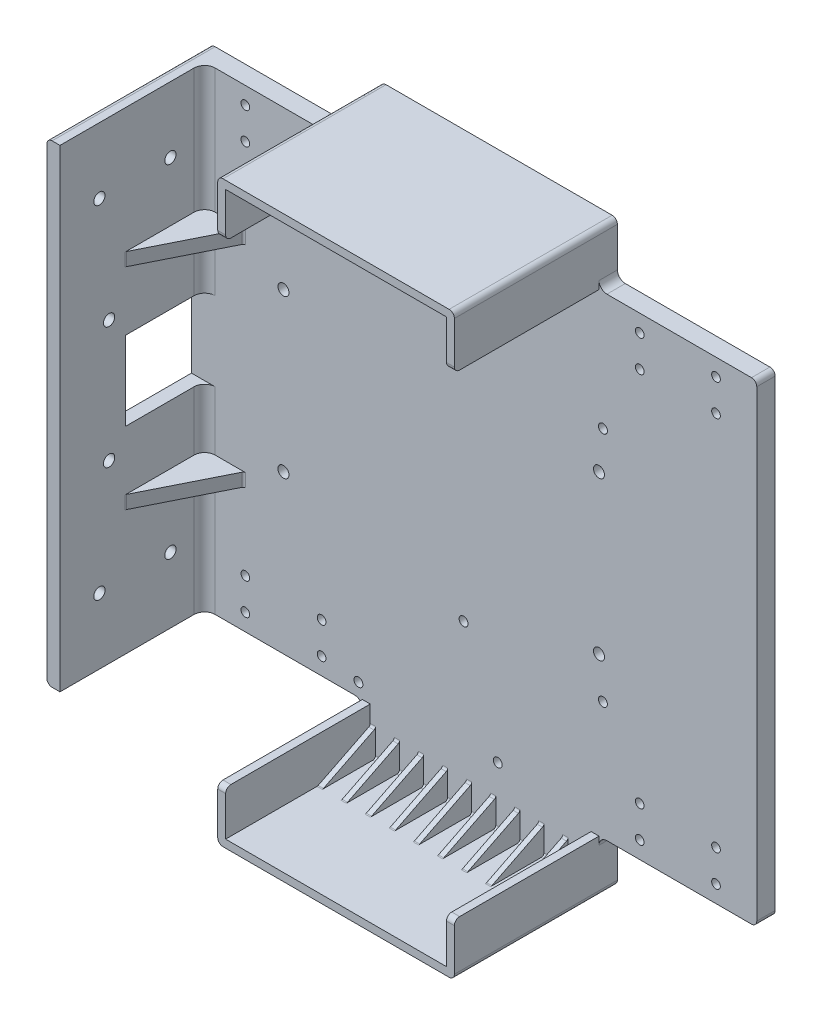
from build123d import *

# Parameters (mm, degrees)
SKETCH2_W               = 210
SKETCH2_H               = 180
BOSS_EXTRUDE1_DEPTH     = 7
SKETCH3_W               = 90
SKETCH3_H               = 7
BOSS_EXTRUDE2_DEPTH     = 20
SKETCH4_W               = 90
SKETCH4_H               = 7
BOSS_EXTRUDE3_DEPTH     = 20
SKETCH5_R               = 1.65
SKETCH5_R_2             = 2.1
SKETCH5_R_3             = 1.7
CUT_EXTRUDE1_DEPTH      = 153.23008901
SKETCH10_W              = 5
SKETCH10_H              = 180
SKETCH10_W_2            = 3
SKETCH10_H_2            = 3
SKETCH10_W_3            = 84
SKETCH10_H_3            = 17
BOSS_EXTRUDE4_DEPTH     = 55
SKETCH12_W              = 5
SKETCH12_H              = 180
BOSS_EXTRUDE5_DEPTH     = 7
FILLET2_R               = 2
FILLET10_R              = 3
FILLET11_R              = 3
FILLET13_R              = 3
FILLET15_R              = 3
FILLET20_R              = 2
BOSS_EXTRUDE6_DEPTH     = 2
LPATTERN1_COUNT         = 10
LPATTERN1_PITCH         = 9.15
MIRROR1_COPY_1_DEPTH    = 2
MIRROR1_COPY_2_DEPTH    = 2
MIRROR1_COPY_3_DEPTH    = 2
MIRROR1_COPY_4_DEPTH    = 2
MIRROR1_COPY_5_DEPTH    = 2
MIRROR1_COPY_6_DEPTH    = 2
MIRROR1_COPY_7_DEPTH    = 2
MIRROR1_COPY_8_DEPTH    = 2
MIRROR1_COPY_9_DEPTH    = 2
MIRROR1_COPY_10_DEPTH   = 2
FILLET24_R              = 4
SKETCH17_R              = 2.15
CUT_EXTRUDE2_DEPTH      = 10
FILLET25_R              = 1
RIB1_REACH              = 198.071
SKETCH18_WALL_W         = 427.683850784
SKETCH18_WALL_H         = 5
RIB2_REACH              = 198.071
SKETCH19_WALL_W         = 427.683850784
SKETCH19_WALL_H         = 5
FILLET26_R              = 1
FILLET27_R              = 1
CUT_EXTRUDE3_DEPTH      = 10
CUT_EXTRUDE3_DEPTH_BACK = 10
SKETCH20_W              = 30
SKETCH20_H              = 30
SKETCH21_R              = 2.15
CUT_EXTRUDE4_DEPTH      = 10
SKETCH22_R              = 2.15
CUT_EXTRUDE5_DEPTH      = 10
FILLET29_R              = 2
FILLET30_R              = 2


with BuildPart() as part:
    # Sketch2 → Boss-Extrude1 (new body)
    with BuildSketch(Plane.XY):
        Rectangle(SKETCH2_W, SKETCH2_H)
    extrude(amount=BOSS_EXTRUDE1_DEPTH)

    # Sketch3 → Boss-Extrude2 (add)
    with BuildSketch(Plane(origin=(0, -90, 0), x_dir=(-1, 0, 0), z_dir=(0, -1, 0))):
        with Locations((0, -3.5)):
            Rectangle(SKETCH3_W, SKETCH3_H)
    extrude(amount=BOSS_EXTRUDE2_DEPTH)

    # Sketch4 → Boss-Extrude3 (add)
    with BuildSketch(Plane(origin=(0, 90, 0), x_dir=(1, 0, 0), z_dir=(0, 1, 0))):
        with Locations((0, -3.5)):
            Rectangle(SKETCH4_W, SKETCH4_H)
    extrude(amount=BOSS_EXTRUDE3_DEPTH)

    # Sketch5 → Cut-Extrude1 (cut, through all)
    with BuildSketch(Plane.XY.offset(7)):
        with Locations((89.5, 83.5)):
            Circle(SKETCH5_R)
        with Locations((89.5, 71.5)):
            Circle(SKETCH5_R)
        with Locations((60.5, 83.5)):
            Circle(SKETCH5_R)
        with Locations((60.5, 71.5)):
            Circle(SKETCH5_R)
        with Locations((-60.5, 71.5)):
            Circle(SKETCH5_R)
        with Locations((-60.5, 83.5)):
            Circle(SKETCH5_R)
        with Locations((-89.5, 71.5)):
            Circle(SKETCH5_R)
        with Locations((-89.5, 83.5)):
            Circle(SKETCH5_R)
        with Locations((-89.5, -83.5)):
            Circle(SKETCH5_R)
        with Locations((-89.5, -71.5)):
            Circle(SKETCH5_R)
        with Locations((-60.5, -83.5)):
            Circle(SKETCH5_R)
        with Locations((-60.5, -71.5)):
            Circle(SKETCH5_R)
        with Locations((60.5, -71.5)):
            Circle(SKETCH5_R)
        with Locations((60.5, -83.5)):
            Circle(SKETCH5_R)
        with Locations((89.5, -71.5)):
            Circle(SKETCH5_R)
        with Locations((89.5, -83.5)):
            Circle(SKETCH5_R)
        with Locations((45, 30)):
            Circle(SKETCH5_R_2)
        with Locations((45, -30)):
            Circle(SKETCH5_R_2)
        with Locations((-75, 30)):
            Circle(SKETCH5_R_2)
        with Locations((-75, -30)):
            Circle(SKETCH5_R_2)
        with Locations((-46.5, -85)):
            Circle(SKETCH5_R_3)
        with Locations((-6.5, -45)):
            Circle(SKETCH5_R_3)
        with Locations((6.5, -85)):
            Circle(SKETCH5_R_3)
        with Locations((46.5, -45)):
            Circle(SKETCH5_R_3)
        with Locations((46.5, 45)):
            Circle(SKETCH5_R_3)
        with Locations((6.5, 85)):
            Circle(SKETCH5_R_3)
        with Locations((-6.5, 45)):
            Circle(SKETCH5_R_3)
        with Locations((-46.5, 85)):
            Circle(SKETCH5_R_3)
    extrude(amount=-CUT_EXTRUDE1_DEPTH, mode=Mode.SUBTRACT)

    # Sketch10 → Boss-Extrude4 (add)
    with BuildSketch(Plane.XY.offset(7)):
        with Locations((-107.5, 0)):
            Rectangle(SKETCH10_W, SKETCH10_H)
        with Locations((-43.5, 108.5)):
            Rectangle(SKETCH10_W_2, SKETCH10_H_2)
        with Locations((0, 108.5)):
            Rectangle(SKETCH10_W_3, SKETCH10_H_2)
        with Locations((-43.5, 98.5)):
            Rectangle(SKETCH10_W_2, SKETCH10_H_3)
        with Locations((43.5, 108.5)):
            Rectangle(SKETCH10_W_2, SKETCH10_H_2)
        with Locations((43.5, 98.5)):
            Rectangle(SKETCH10_W_2, SKETCH10_H_3)
        with Locations((43.5, -108.5)):
            Rectangle(SKETCH10_W_2, SKETCH10_H_2)
        with Locations((0, -108.5)):
            Rectangle(SKETCH10_W_3, SKETCH10_H_2)
        with Locations((43.5, -98.5)):
            Rectangle(SKETCH10_W_2, SKETCH10_H_3)
        with Locations((-43.5, -108.5)):
            Rectangle(SKETCH10_W_2, SKETCH10_H_2)
        with Locations((-43.5, -98.5)):
            Rectangle(SKETCH10_W_2, SKETCH10_H_3)
    extrude(amount=BOSS_EXTRUDE4_DEPTH)


with BuildPart() as boss_extrude4_piece_1:
    # of the separate pieces the step leaves, piece 1, a body of its own (boss_extrude4_pieces)
    add(part.part.solids().sort_by_distance((-105, -90, 0))[0])



with BuildPart() as boss_extrude4_piece_2:
    # of the separate pieces the step leaves, piece 2, a body of its own (boss_extrude4_pieces)
    add(part.part.solids().sort_by_distance((-105, -90, 62))[0])


with BuildPart() as boss_extrude4_piece_1_1:
    add(boss_extrude4_piece_1.part)

    add(boss_extrude4_piece_2.part)  # Boss-Extrude5 merges Boss-Extrude4 piece 2
    # Sketch12 → Boss-Extrude5 (add)
    with BuildSketch(Plane(origin=(0, 0, 7), x_dir=(-1, 0, 0), z_dir=(0, 0, -1))):
        with Locations((107.5, 0)):
            Rectangle(SKETCH12_W, SKETCH12_H)
    extrude(amount=BOSS_EXTRUDE5_DEPTH)

    # Fillet2
    fillet2_edges = [boss_extrude4_piece_1_1.edges().sort_by_distance(p)[0] for p in [
        (-45, 110, 31),
    ]]
    fillet(fillet2_edges, radius=FILLET2_R)

    # Fillet10
    fillet10_edges = [boss_extrude4_piece_1_1.edges().sort_by_distance(p)[0] for p in [
        (-45, 90, 3.5),
    ]]
    fillet(fillet10_edges, radius=FILLET10_R)

    # Fillet11
    fillet11_edges = [boss_extrude4_piece_1_1.edges().sort_by_distance(p)[0] for p in [
        (45, 90, 3.5),
    ]]
    fillet(fillet11_edges, radius=FILLET11_R)

    # Fillet13
    fillet13_edges = [boss_extrude4_piece_1_1.edges().sort_by_distance(p)[0] for p in [
        (45, -90, 3.5),
    ]]
    fillet(fillet13_edges, radius=FILLET13_R)

    # Fillet15
    fillet15_edges = [boss_extrude4_piece_1_1.edges().sort_by_distance(p)[0] for p in [
        (-45, -90, 3.5),
    ]]
    fillet(fillet15_edges, radius=FILLET15_R)

    # Fillet20
    fillet20_edges = [boss_extrude4_piece_1_1.edges().sort_by_distance(p)[0] for p in [
        (43.5, -90, 62),
        (-43.5, -90, 62),
        (-43.5, 90, 62),
        (43.5, 90, 62),
    ]]
    fillet(fillet20_edges, radius=FILLET20_R)

    # Sketch16 → Boss-Extrude6 (add)
    with BuildSketch(Plane(origin=(-42, 0, 0), x_dir=(0, 0, -1), z_dir=(1, 0, 0))):
        Polygon((-27, 107), (-7, 97), (-7, 107), align=None)
    boss_extrude6 = extrude(amount=BOSS_EXTRUDE6_DEPTH)

    # LPattern1: Boss-Extrude6 ×10
    with Locations(*[(i * LPATTERN1_PITCH, 0, 0) for i in range(1, LPATTERN1_COUNT)]):
        add(boss_extrude6)

    # Mirror1 copy 1 sketch → Mirror1 copy 1 (add)
    with BuildSketch(Plane(origin=(-32.85, 0, 0), x_dir=(0, 0, -1), z_dir=(1, 0, 0))):
        Polygon((-27, -107), (-7, -97), (-7, -107), align=None)
    extrude(amount=MIRROR1_COPY_1_DEPTH)

    # Mirror1 copy 2 sketch → Mirror1 copy 2 (add)
    with BuildSketch(Plane(origin=(-23.7, 0, 0), x_dir=(0, 0, -1), z_dir=(1, 0, 0))):
        Polygon((-27, -107), (-7, -97), (-7, -107), align=None)
    extrude(amount=MIRROR1_COPY_2_DEPTH)

    # Mirror1 copy 3 sketch → Mirror1 copy 3 (add)
    with BuildSketch(Plane(origin=(-14.55, 0, 0), x_dir=(0, 0, -1), z_dir=(1, 0, 0))):
        Polygon((-27, -107), (-7, -97), (-7, -107), align=None)
    extrude(amount=MIRROR1_COPY_3_DEPTH)

    # Mirror1 copy 4 sketch → Mirror1 copy 4 (add)
    with BuildSketch(Plane(origin=(-5.4, 0, 0), x_dir=(0, 0, -1), z_dir=(1, 0, 0))):
        Polygon((-27, -107), (-7, -97), (-7, -107), align=None)
    extrude(amount=MIRROR1_COPY_4_DEPTH)

    # Mirror1 copy 5 sketch → Mirror1 copy 5 (add)
    with BuildSketch(Plane(origin=(3.75, 0, 0), x_dir=(0, 0, -1), z_dir=(1, 0, 0))):
        Polygon((-27, -107), (-7, -97), (-7, -107), align=None)
    extrude(amount=MIRROR1_COPY_5_DEPTH)

    # Mirror1 copy 6 sketch → Mirror1 copy 6 (add)
    with BuildSketch(Plane(origin=(12.9, 0, 0), x_dir=(0, 0, -1), z_dir=(1, 0, 0))):
        Polygon((-27, -107), (-7, -97), (-7, -107), align=None)
    extrude(amount=MIRROR1_COPY_6_DEPTH)

    # Mirror1 copy 7 sketch → Mirror1 copy 7 (add)
    with BuildSketch(Plane(origin=(22.05, 0, 0), x_dir=(0, 0, -1), z_dir=(1, 0, 0))):
        Polygon((-27, -107), (-7, -97), (-7, -107), align=None)
    extrude(amount=MIRROR1_COPY_7_DEPTH)

    # Mirror1 copy 8 sketch → Mirror1 copy 8 (add)
    with BuildSketch(Plane(origin=(31.2, 0, 0), x_dir=(0, 0, -1), z_dir=(1, 0, 0))):
        Polygon((-27, -107), (-7, -97), (-7, -107), align=None)
    extrude(amount=MIRROR1_COPY_8_DEPTH)

    # Mirror1 copy 9 sketch → Mirror1 copy 9 (add)
    with BuildSketch(Plane(origin=(40.35, 0, 0), x_dir=(0, 0, -1), z_dir=(1, 0, 0))):
        Polygon((-27, -107), (-7, -97), (-7, -107), align=None)
    extrude(amount=MIRROR1_COPY_9_DEPTH)

    # Mirror1 copy 10 sketch → Mirror1 copy 10 (add)
    with BuildSketch(Plane(origin=(-42, 0, 0), x_dir=(0, 0, -1), z_dir=(1, 0, 0))):
        Polygon((-27, -107), (-7, -97), (-7, -107), align=None)
    extrude(amount=MIRROR1_COPY_10_DEPTH)

    # Fillet24
    fillet24_edges = [boss_extrude4_piece_1_1.edges().sort_by_distance(p)[0] for p in [
        (-105, 0, 7),
    ]]
    fillet(fillet24_edges, radius=FILLET24_R)

    # Sketch17 → Cut-Extrude2 (cut)
    with BuildSketch(Plane(origin=(-105, 0, 0), x_dir=(0, 0, -1), z_dir=(1, 0, 0))):
        with Locations((-43.32, -23.15)):
            Circle(SKETCH17_R)
    cut_extrude2 = extrude(amount=-CUT_EXTRUDE2_DEPTH, mode=Mode.SUBTRACT)

    # Mirror2: Cut-Extrude2 across plane
    add(cut_extrude2.mirror(Plane(origin=(0, 0, 0), x_dir=(0, 0, 1), z_dir=(0, -1, 0))), mode=Mode.SUBTRACT)

    # Fillet25
    fillet25_edges = [boss_extrude4_piece_1_1.edges().sort_by_distance(p)[0] for p in [
        (-36.425, -107, 7),
        (-27.275, -107, 7),
        (-18.125, -107, 7),
        (-8.975, -107, 7),
        (0.175, -107, 7),
        (9.325, -107, 7),
        (18.475, -107, 7),
        (27.625, -107, 7),
        (36.775, -107, 7),
        (-36.425, 107, 7),
        (-27.275, 107, 7),
        (-18.125, 107, 7),
        (-8.975, 107, 7),
        (0.175, 107, 7),
        (9.325, 107, 7),
        (18.475, 107, 7),
        (27.625, 107, 7),
        (36.775, 107, 7),
    ]]
    fillet(fillet25_edges, radius=FILLET25_R)

    # Sketch18 wall → Rib1 (add, up to next)
    with BuildSketch(Plane(origin=(-97.5, -40, 22), x_dir=(0.4472135955, 0, -0.894427191), z_dir=(0.894427191, 0, 0.4472135955)), mode=Mode.PRIVATE) as rib1_sk1:
        Rectangle(SKETCH18_WALL_W, SKETCH18_WALL_H)
    rib1_tool1 = extrude(rib1_sk1.sketch, amount=-RIB1_REACH, mode=Mode.PRIVATE) - boss_extrude4_piece_1_1.part
    add(rib1_tool1.solids().sort_by_distance((-97.5, -40, 22))[0])

    # Sketch19 wall → Rib2 (add, up to next)
    with BuildSketch(Plane(origin=(-97.5, 40, 22), x_dir=(0.4472135955, 0, -0.894427191), z_dir=(0.894427191, 0, 0.4472135955)), mode=Mode.PRIVATE) as rib2_sk1:
        Rectangle(SKETCH19_WALL_W, SKETCH19_WALL_H)
    rib2_tool1 = extrude(rib2_sk1.sketch, amount=-RIB2_REACH, mode=Mode.PRIVATE) - boss_extrude4_piece_1_1.part
    add(rib2_tool1.solids().sort_by_distance((-97.5, 40, 22))[0])

    # Fillet26
    fillet26_edges = [boss_extrude4_piece_1_1.edges().sort_by_distance(p)[0] for p in [
        (41.175, 107, 27),
        (32.2, 107, 27),
        (23.05, 107, 27),
        (13.9, 107, 27),
        (4.75, 107, 27),
        (-4.4, 107, 27),
        (-13.55, 107, 27),
        (-22.7, 107, 27),
        (-31.85, 107, 27),
        (-41, 107, 27),
        (41.175, -107, 27),
        (32.2, -107, 27),
        (23.05, -107, 27),
        (13.9, -107, 27),
        (4.75, -107, 27),
        (-4.4, -107, 27),
        (-13.55, -107, 27),
        (-22.7, -107, 27),
        (-31.85, -107, 27),
        (-41, -107, 27),
    ]]
    fillet(fillet26_edges, radius=FILLET26_R)

    # Fillet27
    fillet27_edges = [boss_extrude4_piece_1_1.edges().sort_by_distance(p)[0] for p in [
        (-90, 40, 7),
        (-105, 40, 37),
        (-90, -40, 7),
        (-105, -40, 37),
        (41.175, 97, 7),
        (32.2, 97, 7),
        (23.05, 97, 7),
        (13.9, 97, 7),
        (4.75, 97, 7),
        (-4.4, 97, 7),
        (-13.55, 97, 7),
        (-22.7, 97, 7),
        (-31.85, 97, 7),
        (-41, 97, 7),
        (41.175, -97, 7),
        (32.2, -97, 7),
        (23.05, -97, 7),
        (13.9, -97, 7),
        (4.75, -97, 7),
        (-4.4, -97, 7),
        (-13.55, -97, 7),
        (-22.7, -97, 7),
        (-31.85, -97, 7),
        (-41, -97, 7),
    ]]
    fillet(fillet27_edges, radius=FILLET27_R)

    # Sketch20 → Cut-Extrude3 (cut, two sides: drawn at the far end of the back side and taken through both)
    with BuildSketch(Plane(origin=(-105, 0, 0), x_dir=(0, 0, -1), z_dir=(1, 0, 0)).offset(-CUT_EXTRUDE3_DEPTH_BACK)):
        with Locations((-22, 0)):
            Rectangle(SKETCH20_W, SKETCH20_H)
    extrude(amount=CUT_EXTRUDE3_DEPTH + CUT_EXTRUDE3_DEPTH_BACK, mode=Mode.SUBTRACT)

    # Sketch21 → Cut-Extrude4 (cut)
    with BuildSketch(Plane(origin=(-105, 0, 0), x_dir=(0, 0, -1), z_dir=(1, 0, 0))):
        with Locations((-47, -65)):
            Circle(SKETCH21_R)
    cut_extrude4 = extrude(amount=-CUT_EXTRUDE4_DEPTH, mode=Mode.SUBTRACT)

    # Sketch22 → Cut-Extrude5 (cut)
    with BuildSketch(Plane(origin=(-105, 0, 0), x_dir=(0, 0, -1), z_dir=(1, 0, 0))):
        with Locations((-20, -65)):
            Circle(SKETCH22_R)
    cut_extrude5 = extrude(amount=-CUT_EXTRUDE5_DEPTH, mode=Mode.SUBTRACT)

    # Mirror3: Cut-Extrude4, Cut-Extrude5 across plane
    add(cut_extrude4.mirror(Plane(origin=(0, 0, 0), x_dir=(0, 0, 1), z_dir=(0, -1, 0))), mode=Mode.SUBTRACT)
    add(cut_extrude5.mirror(Plane(origin=(0, 0, 0), x_dir=(0, 0, 1), z_dir=(0, -1, 0))), mode=Mode.SUBTRACT)

    # Fillet29
    fillet29_edges = [boss_extrude4_piece_1_1.edges().sort_by_distance(p)[0] for p in [
        (-45, -110, 31),
        (45, -110, 31),
        (105, -90, 3.5),
        (105, 90, 3.5),
        (45, 110, 31),
    ]]
    fillet(fillet29_edges, radius=FILLET29_R)

    # Fillet30
    fillet30_edges = [boss_extrude4_piece_1_1.edges().sort_by_distance(p)[0] for p in [
        (-110, 90, 31),
        (-110, -90, 31),
    ]]
    fillet(fillet30_edges, radius=FILLET30_R)


solid = boss_extrude4_piece_1_1.part
